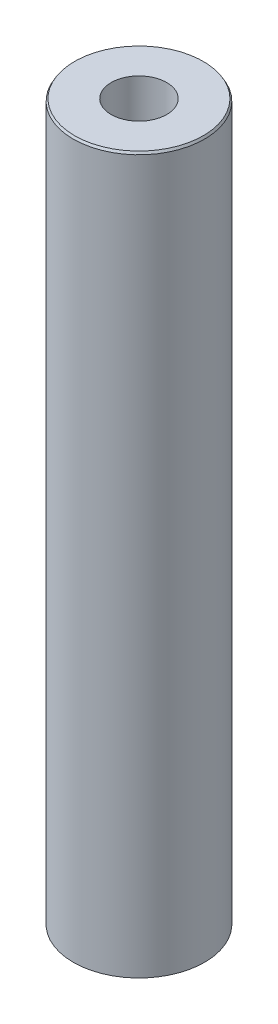
from build123d import *
from OCP.BRepFilletAPI import BRepFilletAPI_MakeChamfer

# Parameters (mm, degrees)
SKETCH1_R           = 55
BOSS_EXTRUDE1_DEPTH = 600
SKETCH2_R           = 23.25089711
CUT_EXTRUDE1_DEPTH  = 606.020660804
CHAMFER1_SIZE       = 1.916928637
CHAMFER1_SIZE2      = 1.106739264


with BuildPart() as part:
    # Sketch1 → Boss-Extrude1 (new body)
    with BuildSketch(Plane(origin=(0, 0, 0), x_dir=(1, 0, 0), z_dir=(0, 1, 0))):
        Circle(SKETCH1_R)
    extrude(amount=BOSS_EXTRUDE1_DEPTH)

    # Sketch2 → Cut-Extrude1 (cut, through all)
    with BuildSketch(Plane(origin=(0, 0, 0), x_dir=(1, 0, 0), z_dir=(0, 1, 0))):
        Circle(SKETCH2_R)
    extrude(amount=CUT_EXTRUDE1_DEPTH, mode=Mode.SUBTRACT)

    # Chamfer1: one chamfer whose edges measure the first distance from different faces: ONE call of the kernel's chamfer builder (chamfer() names one face for all edges)
    chamfer1_edges_1 = [part.edges().sort_by_distance(p)[0] for p in [
        (-55, 600, 0),
    ]]
    chamfer1_side_1 = [part.faces().sort_by_distance(p)[0] for p in [
        (-55, 300, 0),
    ]]
    chamfer1_edges_2 = [part.edges().sort_by_distance(p)[0] for p in [
        (-55, 0, 0),
    ]]
    chamfer1_side_2 = [part.faces().sort_by_distance(p)[0] for p in [
        (-53.444365081, 0, 0),
    ]]
    chamfer1 = BRepFilletAPI_MakeChamfer(part.part.solid().wrapped)
    for e in chamfer1_edges_1:
        chamfer1.Add(CHAMFER1_SIZE, CHAMFER1_SIZE2, e.wrapped, chamfer1_side_1[0].wrapped)  # the first distance lies on this face
    for e in chamfer1_edges_2:
        chamfer1.Add(CHAMFER1_SIZE, CHAMFER1_SIZE2, e.wrapped, chamfer1_side_2[0].wrapped)  # the first distance lies on this face
    add(Compound.cast(chamfer1.Shape()), mode=Mode.REPLACE)


solid = part.part
